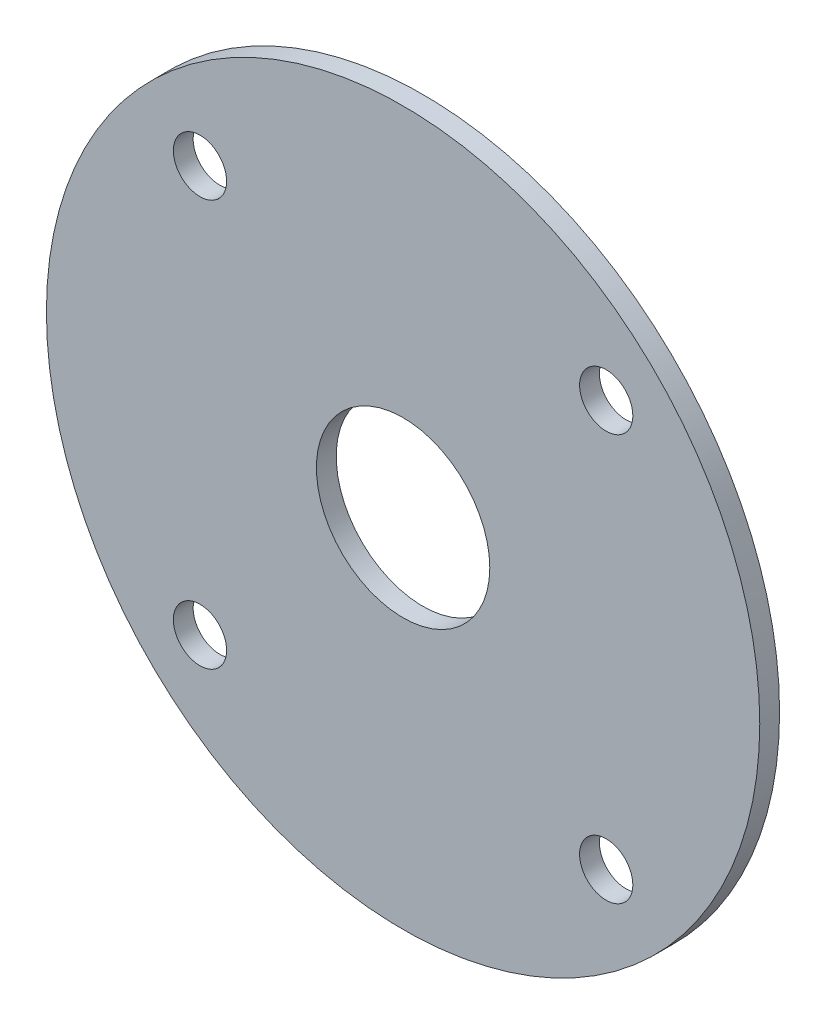
from build123d import *

# Parameters (mm, degrees)
SKETCH2_R          = 114.3
SKETCH2_R_2        = 27.78125
EXTRUDE1_DEPTH     = 6.35
CUT_EXTRUDE1_REACH = 163.769
SKETCH3_R          = 8.5328125


with BuildPart() as part:
    # Sketch2 → Extrude1 (new body)
    with BuildSketch(Plane.XY):
        Circle(SKETCH2_R)
        Circle(SKETCH2_R_2, mode=Mode.SUBTRACT)
    extrude(amount=EXTRUDE1_DEPTH)

    # Sketch3 → Cut-Extrude1 (cut, up to next)
    with BuildSketch(Plane.XY.offset(6.35), mode=Mode.PRIVATE) as cut_extrude1_sk1:
        with Locations((-65.0875, -65.0875)):
            Circle(SKETCH3_R)
    cut_extrude1_tool1 = extrude(cut_extrude1_sk1.sketch, amount=-CUT_EXTRUDE1_REACH, mode=Mode.PRIVATE) & part.part
    # Sketch3 → Cut-Extrude1 (cut, up to next)
    with BuildSketch(Plane.XY.offset(6.35), mode=Mode.PRIVATE) as cut_extrude1_sk2:
        with Locations((-65.0875, 65.0875)):
            Circle(SKETCH3_R)
    cut_extrude1_tool2 = extrude(cut_extrude1_sk2.sketch, amount=-CUT_EXTRUDE1_REACH, mode=Mode.PRIVATE) & part.part
    # Sketch3 → Cut-Extrude1 (cut, up to next)
    with BuildSketch(Plane.XY.offset(6.35), mode=Mode.PRIVATE) as cut_extrude1_sk3:
        with Locations((65.0875, 65.0875)):
            Circle(SKETCH3_R)
    cut_extrude1_tool3 = extrude(cut_extrude1_sk3.sketch, amount=-CUT_EXTRUDE1_REACH, mode=Mode.PRIVATE) & part.part
    # Sketch3 → Cut-Extrude1 (cut, up to next)
    with BuildSketch(Plane.XY.offset(6.35), mode=Mode.PRIVATE) as cut_extrude1_sk4:
        with Locations((65.0875, -65.0875)):
            Circle(SKETCH3_R)
    cut_extrude1_tool4 = extrude(cut_extrude1_sk4.sketch, amount=-CUT_EXTRUDE1_REACH, mode=Mode.PRIVATE) & part.part
    add(cut_extrude1_tool1.solids().sort_by_distance((-65.0875, -65.0875, 6.35))[0], mode=Mode.SUBTRACT)
    add(cut_extrude1_tool2.solids().sort_by_distance((-65.0875, 65.0875, 6.35))[0], mode=Mode.SUBTRACT)
    add(cut_extrude1_tool3.solids().sort_by_distance((65.0875, 65.0875, 6.35))[0], mode=Mode.SUBTRACT)
    add(cut_extrude1_tool4.solids().sort_by_distance((65.0875, -65.0875, 6.35))[0], mode=Mode.SUBTRACT)


solid = part.part
